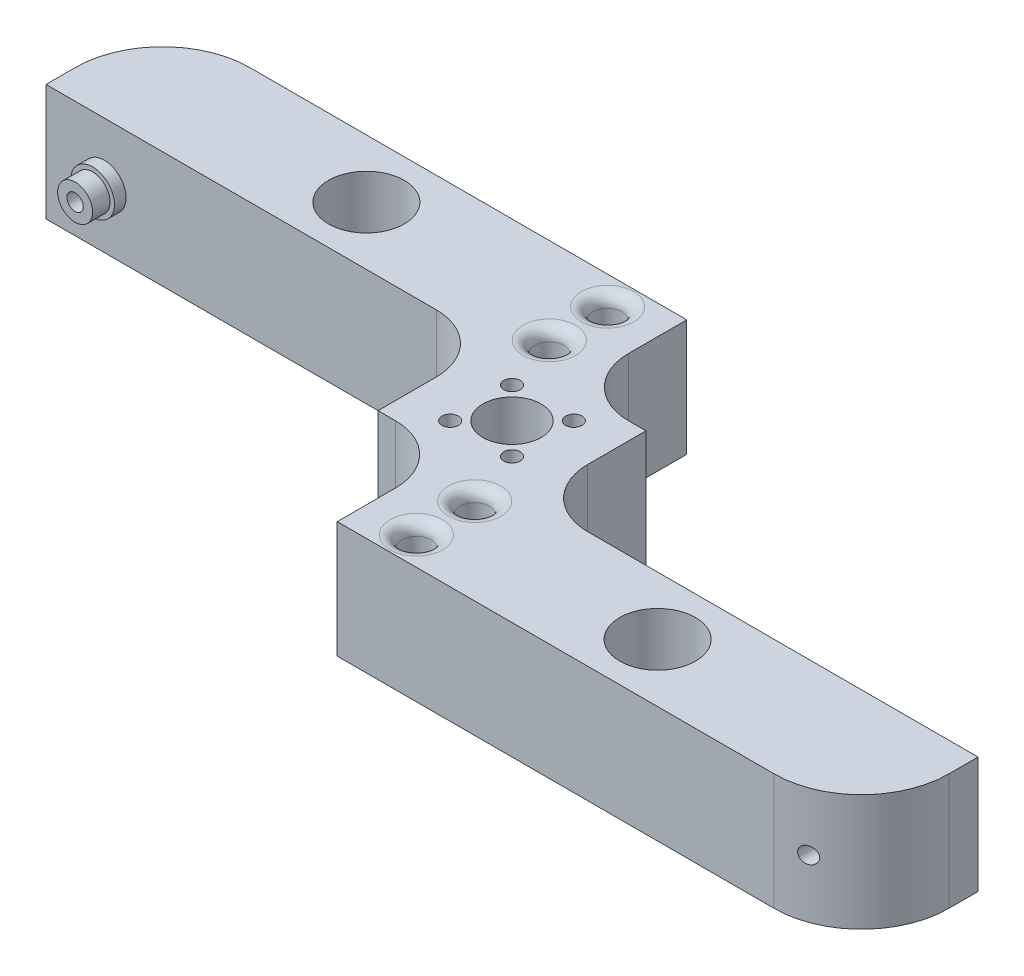
from build123d import *

# Parameters (mm, degrees)
BOSS_EXTRUDE1_DEPTH     = 20
SKETCH2_R               = 5
SKETCH2_R_2             = 1.4
CUT_EXTRUDE1_DEPTH      = 97.953597148
SKETCH3_W               = 77
SKETCH3_H               = 20
CUT_EXTRUDE2_DEPTH      = 97.953597148
SKETCH4_R               = 3.75
BOSS_EXTRUDE2_DEPTH     = 2
SKETCH5_R               = 3
BOSS_EXTRUDE3_DEPTH     = 3
SKETCH6_R               = 1.4
CUT_EXTRUDE3_DEPTH      = 99.615414617
SKETCH7_R               = 3.75
BOSS_EXTRUDE4_DEPTH     = 2
SKETCH8_R               = 3
BOSS_EXTRUDE5_DEPTH     = 3
SKETCH9_R               = 1.4
CUT_EXTRUDE4_DEPTH      = 99.615414617
FILLET1_R               = 10
CUT_EXTRUDE5_DEPTH      = 97.953597148
CUT_EXTRUDE5_DEPTH_BACK = 97.953597148
SKETCH12_R              = 2.5
FILLET2_R               = 2
FILLET3_R               = 2
CUT_EXTRUDE6_DEPTH      = 97.953597169
CUT_EXTRUDE6_DEPTH_BACK = 97.953597169
SKETCH13_R              = 6.5
FILLET4_R               = 15


with BuildPart() as part:
    # Sketch1 → Boss-Extrude1 (new body)
    with BuildSketch(Plane(origin=(0, 0, 0), x_dir=(1, 0, 0), z_dir=(0, 1, 0))):
        Polygon((-90, 10), (-90, 30), (0, 30), (0, 10), (90, 10), (90, -10), (90, -30), (0, -30), (0, -10), (-90, -10), align=None)
    extrude(amount=BOSS_EXTRUDE1_DEPTH)

    # Sketch2 → Cut-Extrude1 (cut, through all)
    with BuildSketch(Plane(origin=(0, 20, 0), x_dir=(1, 0, 0), z_dir=(0, 1, 0))):
        with Locations(Location((0, 0, 0), (0, 0, 270))):
            Circle(SKETCH2_R)
        with Locations(Location((-5.303300859, 5.303300859, 0), (0, 0, 270))):
            Circle(SKETCH2_R_2)
        with Locations(Location((5.303300859, 5.303300859, 0), (0, 0, 270))):
            Circle(SKETCH2_R_2)
        with Locations(Location((5.303300859, -5.303300859, 0), (0, 0, 270))):
            Circle(SKETCH2_R_2)
        with Locations(Location((-5.303300859, -5.303300859, 0), (0, 0, 270))):
            Circle(SKETCH2_R_2)
    extrude(amount=-CUT_EXTRUDE1_DEPTH, mode=Mode.SUBTRACT)

    # Sketch3 → Cut-Extrude2 (cut, through all)
    with BuildSketch(Plane(origin=(0, 20, 0), x_dir=(1, 0, 0), z_dir=(0, 1, 0))):
        with Locations((-51.5, 0)):
            Rectangle(SKETCH3_W, SKETCH3_H)
    cut_extrude2 = extrude(amount=-CUT_EXTRUDE2_DEPTH, mode=Mode.SUBTRACT)

    # Mirror1: Cut-Extrude2 across plane
    add(cut_extrude2.mirror(Plane(origin=(0, 0, 0), x_dir=(0, 0, 1), z_dir=(1, 0, 0))), mode=Mode.SUBTRACT)

    # Sketch4 → Boss-Extrude2 (add)
    with BuildSketch(Plane.XY.offset(-10)):
        with Locations(Location((-80, 10, 0), (0, 0, 180))):
            Circle(SKETCH4_R)
    extrude(amount=BOSS_EXTRUDE2_DEPTH)

    # Sketch5 → Boss-Extrude3 (add)
    with BuildSketch(Plane.XY.offset(-8)):
        with Locations((-80, 10)):
            Circle(SKETCH5_R)
    extrude(amount=BOSS_EXTRUDE3_DEPTH)

    # Sketch6 → Cut-Extrude3 (cut, through all)
    with BuildSketch(Plane.XY.offset(-5)):
        with Locations((-80, 10)):
            Circle(SKETCH6_R)
    extrude(amount=-CUT_EXTRUDE3_DEPTH, mode=Mode.SUBTRACT)

    # Sketch7 → Boss-Extrude4 (add)
    with BuildSketch(Plane(origin=(0, 0, 10), x_dir=(-1, 0, 0), z_dir=(0, 0, -1))):
        with Locations((-80, 10)):
            Circle(SKETCH7_R)
    extrude(amount=BOSS_EXTRUDE4_DEPTH)

    # Sketch8 → Boss-Extrude5 (add)
    with BuildSketch(Plane(origin=(0, 0, 8), x_dir=(-1, 0, 0), z_dir=(0, 0, -1))):
        with Locations((-80, 10)):
            Circle(SKETCH8_R)
    extrude(amount=BOSS_EXTRUDE5_DEPTH)

    # Sketch9 → Cut-Extrude4 (cut, through all)
    with BuildSketch(Plane(origin=(0, 0, 5), x_dir=(-1, 0, 0), z_dir=(0, 0, -1))):
        with Locations((-80, 10)):
            Circle(SKETCH9_R)
    extrude(amount=-CUT_EXTRUDE4_DEPTH, mode=Mode.SUBTRACT)

    # Fillet1
    fillet1_edges = [part.edges().sort_by_distance(p)[0] for p in [
        (0, 10, 10),
        (0, 10, -10),
        (-13, 10, -10),
        (13, 10, 10),
    ]]
    fillet(fillet1_edges, radius=FILLET1_R)

    # Sketch12 → Cut-Extrude5 (cut, two sides: drawn at the far end of the back side and taken through both)
    with BuildSketch(Plane(origin=(0, 20, 0), x_dir=(1, 0, 0), z_dir=(0, 1, 0)).offset(-CUT_EXTRUDE5_DEPTH_BACK)):
        with Locations(Location((8.75, -15.155444566, 0), (0, 0, 270))):
            Circle(SKETCH12_R)
        with Locations(Location((8.75, -25.155444566, 0), (0, 0, 270))):
            Circle(SKETCH12_R)
        with Locations(Location((-8.75, 25.155444566, 0), (0, 0, 270))):
            Circle(SKETCH12_R)
        with Locations(Location((-8.75, 15.155444566, 0), (0, 0, 270))):
            Circle(SKETCH12_R)
    extrude(amount=CUT_EXTRUDE5_DEPTH + CUT_EXTRUDE5_DEPTH_BACK, mode=Mode.SUBTRACT)

    # Fillet2
    fillet2_edges = [part.edges().sort_by_distance(p)[0] for p in [
        (8.75, 20, 22.655444566),
        (-8.75, 20, -27.655444566),
        (-8.75, 20, -17.655444566),
        (8.75, 20, 12.655444566),
    ]]
    fillet(fillet2_edges, radius=FILLET2_R)

    # Fillet3
    fillet3_edges = [part.edges().sort_by_distance(p)[0] for p in [
        (8.75, 0, 22.655444566),
        (-8.75, 0, -27.655444566),
        (-8.75, 0, -17.655444566),
        (8.75, 0, 12.655444566),
    ]]
    fillet(fillet3_edges, radius=FILLET3_R)

    # Sketch13 → Cut-Extrude6 (cut, two sides: drawn at the far end of the back side and taken through both)
    with BuildSketch(Plane(origin=(0, 20, 0), x_dir=(1, 0, 0), z_dir=(0, 1, 0)).offset(-CUT_EXTRUDE6_DEPTH_BACK)):
        with Locations(Location((-45, 20, 0), (0, 0, 270))):
            Circle(SKETCH13_R)
        with Locations(Location((45, -20, 0), (0, 0, 270))):
            Circle(SKETCH13_R)
    extrude(amount=CUT_EXTRUDE6_DEPTH + CUT_EXTRUDE6_DEPTH_BACK, mode=Mode.SUBTRACT)

    # Fillet4
    # the kernel refuses this fillet: 15 mm, written as the material it takes off along each edge
    with BuildSketch(Plane(origin=(90, -37.5, 30), x_dir=(-1, 0, 0), z_dir=(0, 1, 0))) as fillet4_piece_1:
        with BuildLine():
            CenterArc((FILLET4_R, -FILLET4_R), FILLET4_R, 90, 90)
            Line((0, -FILLET4_R), (0, 0))
            Line((0, 0), (FILLET4_R, 0))
        make_face()
    extrude(amount=95, mode=Mode.SUBTRACT)
    with BuildSketch(Plane(origin=(-90, -37.5, -30), x_dir=(0, 0, 1), z_dir=(0, 1, 0))) as fillet4_piece_2:
        with BuildLine():
            CenterArc((FILLET4_R, FILLET4_R), FILLET4_R, 180, 90)
            Line((0, FILLET4_R), (0, 0))
            Line((0, 0), (FILLET4_R, 0))
        make_face()
    extrude(amount=95, mode=Mode.SUBTRACT)


solid = part.part
